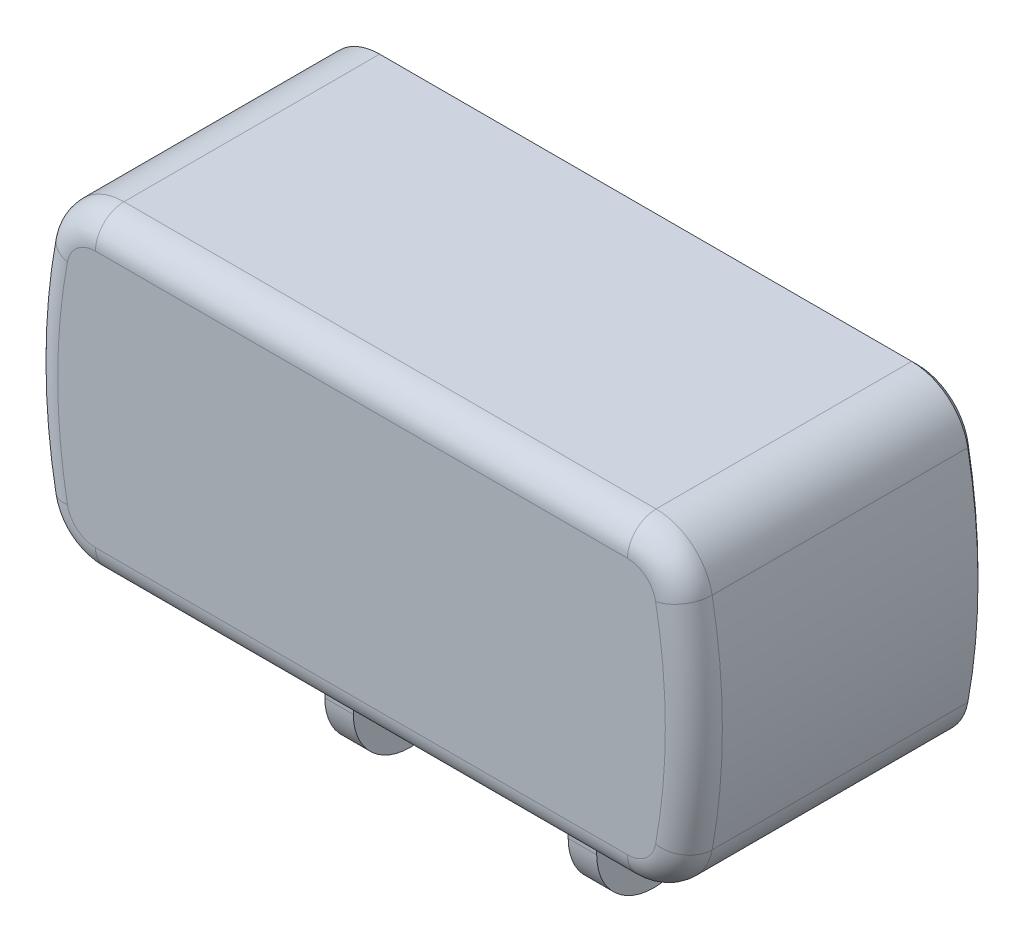
from build123d import *
from OCP.BRepFilletAPI import BRepFilletAPI_MakeChamfer

# Parameters (mm, degrees)
BOSS_EXTRUDE5_DEPTH = 50.8
FILLET9_R           = 5
CHAMFER1_SIZE       = 1
SKETCH8_R           = 1.35
BOSS_EXTRUDE6_DEPTH = 5
CUT_EXTRUDE3_DEPTH  = 20
CHAMFER2_SIZE       = 20
CHAMFER2_SIZE_2     = 0.69841539
SKETCH15_R          = 1.35
CUT_EXTRUDE4_DEPTH  = 5
CUT_EXTRUDE5_REACH  = 96.854


with BuildPart() as part:
    # Sketch2 → Boss-Extrude5 (new body)
    with BuildSketch(Plane.XY):
        with BuildLine():
            Line((46.625, 27.5), (-46.625, 27.5))
            ThreePointArc((-46.625, 27.5), (-53.017219792, 25.190222762), (-56.456518829, 19.327905227))
            ThreePointArc((-56.456518829, 19.327905227), (-58.238005123, 0), (-56.456518829, -19.327905227))
            ThreePointArc((-56.456518829, -19.327905227), (-53.017219792, -25.190222762), (-46.625, -27.5))
            Line((-46.625, -27.5), (46.625, -27.5))
            ThreePointArc((46.625, -27.5), (53.017219792, -25.190222762), (56.456518829, -19.327905227))
            ThreePointArc((56.456518829, -19.327905227), (58.238005123, 0), (56.456518829, 19.327905227))
            ThreePointArc((56.456518829, 19.327905227), (53.017219792, 25.190222762), (46.625, 27.5))
        make_face()
    extrude(amount=BOSS_EXTRUDE5_DEPTH)

    # Fillet9
    fillet9_edges = [part.edges().sort_by_distance(p)[0] for p in [
        (53.017219792, -25.190222762, 50.8),
        (58.238005123, 0, 50.8),
        (53.017219792, 25.190222762, 50.8),
        (0, 27.5, 50.8),
        (-53.017219792, 25.190222762, 50.8),
        (-58.238005123, 0, 50.8),
        (-53.017219792, -25.190222762, 50.8),
        (0, -27.5, 50.8),
    ]]
    fillet(fillet9_edges, radius=FILLET9_R)

    # Chamfer1
    chamfer1_edges = [part.edges().sort_by_distance(p)[0] for p in [
        (58.238005123, 0, 0),
        (53.017219792, -25.190222762, 0),
        (0, -27.5, 0),
        (-53.017219792, -25.190222762, 0),
        (-58.238005123, 0, 0),
        (-53.017219792, 25.190222762, 0),
        (0, 27.5, 0),
        (53.017219792, 25.190222762, 0),
    ]]
    chamfer(chamfer1_edges, length=CHAMFER1_SIZE)

    # Sketch8 → Boss-Extrude6 (add)
    # profile 1 of 2: a face of its own
    with BuildSketch(Plane(origin=(18.825019181, 0, 0), x_dir=(0, 0, -1), z_dir=(1, 0, 0))):
        with BuildLine():
            Line((-13.405087735, -32.61), (-8.405087735, -27.5))
            Line((-8.405087735, -27.5), (-13.405087735, -27.5))
            Line((-13.405087735, -27.5), (-33.413673421, -27.5))
            Line((-33.413673421, -27.5), (-38.413673421, -27.5))
            Line((-38.413673421, -27.5), (-33.405087735, -32.61))
            Line((-33.405087735, -32.61), (-33.405087735, -42.61))
            ThreePointArc((-33.405087735, -42.61), (-23.405087735, -52.61), (-13.405087735, -42.61))
            Line((-13.405087735, -42.61), (-13.405087735, -32.61))
        make_face()
        with BuildLine():
            ThreePointArc((-33.105086536, -42.61), (-23.405087735, -32.910001198), (-13.705088933, -42.61))
            ThreePointArc((-13.705088933, -42.61), (-23.405087735, -52.309998802), (-33.105086536, -42.61))
        make_face(mode=Mode.SUBTRACT)
    # profile 2 of 2: a face of its own
    with BuildSketch(Plane(origin=(18.825019181, 0, 0), x_dir=(0, 0, -1), z_dir=(1, 0, 0))):
        with BuildLine():
            ThreePointArc((-33.105086536, -42.61), (-23.405087735, -52.309998802), (-13.705088933, -42.61))
            ThreePointArc((-13.705088933, -42.61), (-23.405087735, -32.910001198), (-33.105086536, -42.61))
        make_face()
        with Locations((-30.405089608, -42.61)):
            Circle(SKETCH8_R, mode=Mode.SUBTRACT)
        with Locations((-23.405087735, -49.610001873)):
            Circle(SKETCH8_R, mode=Mode.SUBTRACT)
        with Locations((-16.405085862, -42.61)):
            Circle(SKETCH8_R, mode=Mode.SUBTRACT)
        with Locations((-23.405087735, -35.609998127)):
            Circle(SKETCH8_R, mode=Mode.SUBTRACT)
        with BuildLine():
            ThreePointArc((-21.805087735, -42.61), (-23.405087735, -44.21), (-25.005087735, -42.61))
            ThreePointArc((-25.005087735, -42.61), (-23.405087735, -41.01), (-21.805087735, -42.61))
        make_face(mode=Mode.SUBTRACT)
    boss_extrude6 = extrude(amount=BOSS_EXTRUDE6_DEPTH)

    # Mirror1: Boss-Extrude6 across plane
    add(boss_extrude6.mirror(Plane(origin=(0, 0, 0), x_dir=(0, 0, 1), z_dir=(1, 0, 0))))

    # Sketch4 → Cut-Extrude3 (cut)
    with BuildSketch(Plane(origin=(0, 0, 0), x_dir=(-1, 0, 0), z_dir=(0, 0, -1))):
        with BuildLine():
            Line((-40.665, 14.165), (40.665, 14.165))
            ThreePointArc((40.665, 14.165), (44.200533906, 12.700533906), (45.665, 9.165))
            Line((45.665, 9.165), (45.665, -9.165))
            ThreePointArc((45.665, -9.165), (44.200533906, -12.700533906), (40.665, -14.165))
            Line((40.665, -14.165), (-40.665, -14.165))
            ThreePointArc((-40.665, -14.165), (-44.200533906, -12.700533906), (-45.665, -9.165))
            Line((-45.665, -9.165), (-45.665, 9.165))
            ThreePointArc((-45.665, 9.165), (-44.200533906, 12.700533906), (-40.665, 14.165))
        make_face()
    extrude(amount=-CUT_EXTRUDE3_DEPTH, mode=Mode.SUBTRACT)

    # Chamfer2
    chamfer2_edges_1 = [part.edges().sort_by_distance(p)[0] for p in [
        (-45.665, 0, 20),
    ]]
    chamfer2_side_1 = [part.faces().sort_by_distance(p)[0] for p in [
        (-45.665, 0, 19.986031692),
    ]]
    chamfer2_edges_2 = [part.edges().sort_by_distance(p)[0] for p in [
        (-44.200533906, 12.700533906, 20),
    ]]
    chamfer2_side_2 = [part.faces().sort_by_distance(p)[0] for p in [
        (-44.200533906, 12.700533906, 19.986031692),
    ]]
    chamfer2_edges_3 = [part.edges().sort_by_distance(p)[0] for p in [
        (-44.200533906, -12.700533906, 20),
    ]]
    chamfer2_side_3 = [part.faces().sort_by_distance(p)[0] for p in [
        (-44.200533906, -12.700533906, 19.986031692),
    ]]
    chamfer2_edges_4 = [part.edges().sort_by_distance(p)[0] for p in [
        (0, 14.165, 20),
    ]]
    chamfer2_side_4 = [part.faces().sort_by_distance(p)[0] for p in [
        (0, 14.165, 19.986031692),
    ]]
    chamfer2_edges_5 = [part.edges().sort_by_distance(p)[0] for p in [
        (0, -14.165, 20),
    ]]
    chamfer2_side_5 = [part.faces().sort_by_distance(p)[0] for p in [
        (0, -14.165, 19.986031692),
    ]]
    chamfer2_edges_6 = [part.edges().sort_by_distance(p)[0] for p in [
        (44.200533906, 12.700533906, 20),
    ]]
    chamfer2_side_6 = [part.faces().sort_by_distance(p)[0] for p in [
        (44.200533906, 12.700533906, 19.986031692),
    ]]
    chamfer2_edges_7 = [part.edges().sort_by_distance(p)[0] for p in [
        (44.200533906, -12.700533906, 20),
    ]]
    chamfer2_side_7 = [part.faces().sort_by_distance(p)[0] for p in [
        (44.200533906, -12.700533906, 19.986031692),
    ]]
    chamfer2_edges_8 = [part.edges().sort_by_distance(p)[0] for p in [
        (45.665, 0, 20),
    ]]
    chamfer2_side_8 = [part.faces().sort_by_distance(p)[0] for p in [
        (45.665, 0, 19.986031692),
    ]]
    chamfer2 = BRepFilletAPI_MakeChamfer(part.part.solid().wrapped)
    for e in chamfer2_edges_1:
        chamfer2.Add(CHAMFER2_SIZE - 0.0001, CHAMFER2_SIZE_2 - 0.0001, e.wrapped, chamfer2_side_1[0].wrapped)
    for e in chamfer2_edges_2:
        chamfer2.Add(CHAMFER2_SIZE - 0.0001, CHAMFER2_SIZE_2 - 0.0001, e.wrapped, chamfer2_side_2[0].wrapped)
    for e in chamfer2_edges_3:
        chamfer2.Add(CHAMFER2_SIZE - 0.0001, CHAMFER2_SIZE_2 - 0.0001, e.wrapped, chamfer2_side_3[0].wrapped)
    for e in chamfer2_edges_4:
        chamfer2.Add(CHAMFER2_SIZE - 0.0001, CHAMFER2_SIZE_2 - 0.0001, e.wrapped, chamfer2_side_4[0].wrapped)
    for e in chamfer2_edges_5:
        chamfer2.Add(CHAMFER2_SIZE - 0.0001, CHAMFER2_SIZE_2 - 0.0001, e.wrapped, chamfer2_side_5[0].wrapped)
    for e in chamfer2_edges_6:
        chamfer2.Add(CHAMFER2_SIZE - 0.0001, CHAMFER2_SIZE_2 - 0.0001, e.wrapped, chamfer2_side_6[0].wrapped)
    for e in chamfer2_edges_7:
        chamfer2.Add(CHAMFER2_SIZE - 0.0001, CHAMFER2_SIZE_2 - 0.0001, e.wrapped, chamfer2_side_7[0].wrapped)
    for e in chamfer2_edges_8:
        chamfer2.Add(CHAMFER2_SIZE - 0.0001, CHAMFER2_SIZE_2 - 0.0001, e.wrapped, chamfer2_side_8[0].wrapped)
    add(Compound.cast(chamfer2.Shape()), mode=Mode.REPLACE)  # a hair under: the kernel refuses the full size

    # Sketch15 → Cut-Extrude4 (cut)
    with BuildSketch(Plane(origin=(0, 0, 0), x_dir=(-1, 0, 0), z_dir=(0, 0, -1))):
        with Locations((-48.289265859, 18.560867196)):
            Circle(SKETCH15_R)
        with Locations((48.289265859, -18.560867196)):
            Circle(SKETCH15_R)
        with Locations((48.289265859, 18.560867196)):
            Circle(SKETCH15_R)
        with Locations((-48.289265859, -18.560867196)):
            Circle(SKETCH15_R)
    extrude(amount=-CUT_EXTRUDE4_DEPTH, mode=Mode.SUBTRACT)

    # Cut-Extrude5: up to this plane
    cut_extrude5_end = Plane(origin=(-40.665, -13.46658461, 20), z_dir=(0, -0.9993908270190957, 0.03489949670250434))
    # Sketch16 → Cut-Extrude5 (cut, up to the surface)
    with BuildSketch(Plane.XZ.offset(27.5), mode=Mode.PRIVATE) as cut_extrude5_sk1:
        with BuildLine():
            Line((22.750846484, 1.890469849), (22.750846483, 4.590495435))
            add(Edge.make_bspline(
                [(22.750846483, 4.590495435), (22.750837027, 4.775283781), (22.73248867, 4.957224969), (22.66151422, 5.315785643), (22.607726053, 5.494014537), (22.467223433, 5.831520977), (22.381891407, 5.992459845), (22.178053429, 6.297147896), (22.060014741, 6.4405393), (21.673716049, 6.827867738), (21.361341723, 7.036670346), (20.856309918, 7.246376919), (20.679010973, 7.300348953), (20.318322032, 7.372429863), (20.135714984, 7.390453685), (19.950846484, 7.390469849)],
                knots=[0, 0, 0, 0, 0.125, 0.125, 0.25, 0.25, 0.375, 0.375, 0.5, 0.5, 0.75, 0.75, 0.875, 0.875, 1, 1, 1, 1], degree=3))
            Line((19.950846484, 7.390469849), (11.150820748, 7.390469848))
            add(Edge.make_bspline(
                [(11.150820748, 7.390469848), (10.966031816, 7.390460337), (10.784090112, 7.372112007), (10.425528549, 7.301137677), (10.247300018, 7.247346686), (9.909790791, 7.10684451), (9.748851442, 7.021511102), (9.444163129, 6.81766935), (9.300766879, 6.699636548), (8.913443766, 6.313334984), (8.70464106, 6.000960293), (8.49493761, 5.495929858), (8.440966665, 5.318631956), (8.368886124, 4.957943952), (8.350862583, 4.775337528), (8.350846484, 4.590469849)],
                knots=[0, 0, 0, 0, 0.125, 0.125, 0.25, 0.25, 0.375, 0.375, 0.5, 0.5, 0.75, 0.75, 0.875, 0.875, 1, 1, 1, 1], degree=3))
            Line((8.350846484, 4.590469849), (8.350846484, 1.890444263))
            add(Edge.make_bspline(
                [(8.350846484, 1.890444263), (8.35085594, 1.705655915), (8.369204297, 1.523714726), (8.440178749, 1.16515405), (8.493966917, 0.986925155), (8.634469538, 0.649418711), (8.719801566, 0.488479842), (8.923639547, 0.18379179), (9.041678239, 0.040400386), (9.427976936, -0.346928055), (9.740351265, -0.555730668), (10.245383089, -0.765437205), (10.422682029, -0.819409245), (10.783370941, -0.89149025), (10.965977971, -0.909514153), (11.150846484, -0.909530151)],
                knots=[0, 0, 0, 0, 0.125, 0.125, 0.25, 0.25, 0.375, 0.375, 0.5, 0.5, 0.75, 0.75, 0.875, 0.875, 1, 1, 1, 1], degree=3))
            Line((11.150846484, -0.909530151), (19.950871885, -0.90953015))
            add(Edge.make_bspline(
                [(19.950871885, -0.90953015), (20.135660846, -0.909520763), (20.317602552, -0.891172404), (20.676164116, -0.820198035), (20.854392662, -0.766407072), (21.191901959, -0.625904928), (21.352841334, -0.540571521), (21.657529692, -0.336729764), (21.800925955, -0.218696966), (22.18824912, 0.167604602), (22.397051856, 0.479979307), (22.606755334, 0.985009778), (22.66072629, 1.1623077), (22.732806844, 1.522995721), (22.750830385, 1.705602156), (22.750846484, 1.890469849)],
                knots=[0, 0, 0, 0, 0.125, 0.125, 0.25, 0.25, 0.375, 0.375, 0.5, 0.5, 0.75, 0.75, 0.875, 0.875, 1, 1, 1, 1], degree=3))
        make_face()
    cut_extrude5_tool1 = split(extrude(cut_extrude5_sk1.sketch, amount=-CUT_EXTRUDE5_REACH, mode=Mode.PRIVATE), bisect_by=cut_extrude5_end, keep=Keep.BOTH, mode=Mode.PRIVATE)
    add(cut_extrude5_tool1.solids().sort_by_distance((15.550846, -27.5, 3.240452))[0], mode=Mode.SUBTRACT)


solid = part.part
